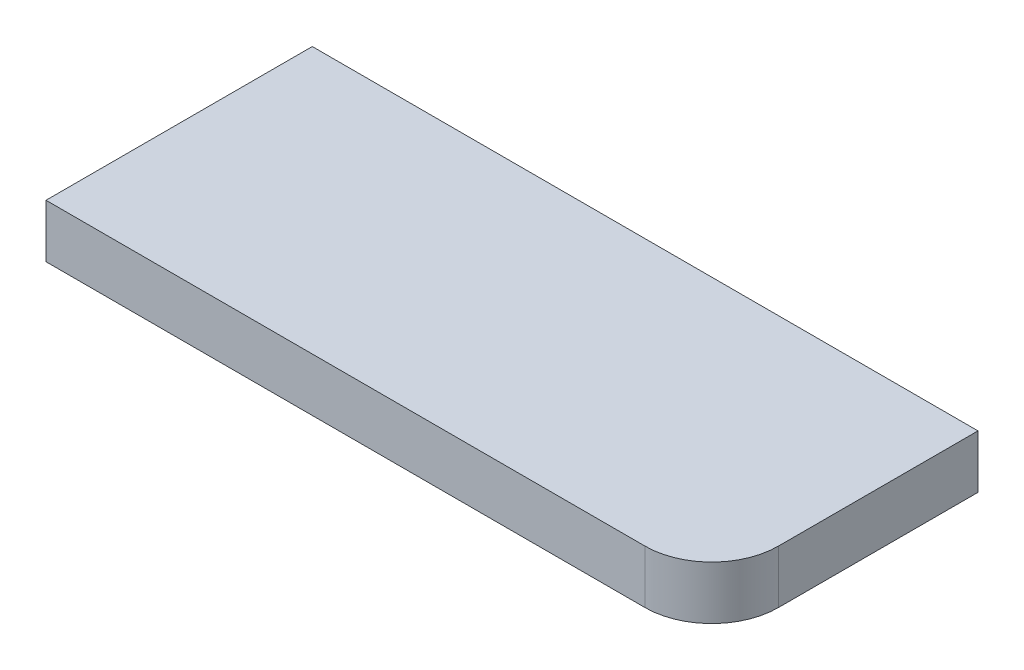
from build123d import *

# Parameters (mm, degrees)
EXTRUDE_1_DEPTH = 8


with BuildPart() as part:
    # Эскиз1 → Бобышка-Вытянуть1 (new body)
    with BuildSketch(Plane(origin=(0, 0, 0), x_dir=(1, 0, 0), z_dir=(0, 1, 0))):
        with BuildLine():
            Line((-50, -20), (40, -20))
            ThreePointArc((40, -20), (47.071067812, -17.071067812), (50, -10))
            Line((50, -10), (50, 20))
            Line((50, 20), (-50, 20))
            Line((-50, 20), (-50, -20))
        make_face()
    extrude(amount=EXTRUDE_1_DEPTH)


solid = part.part
